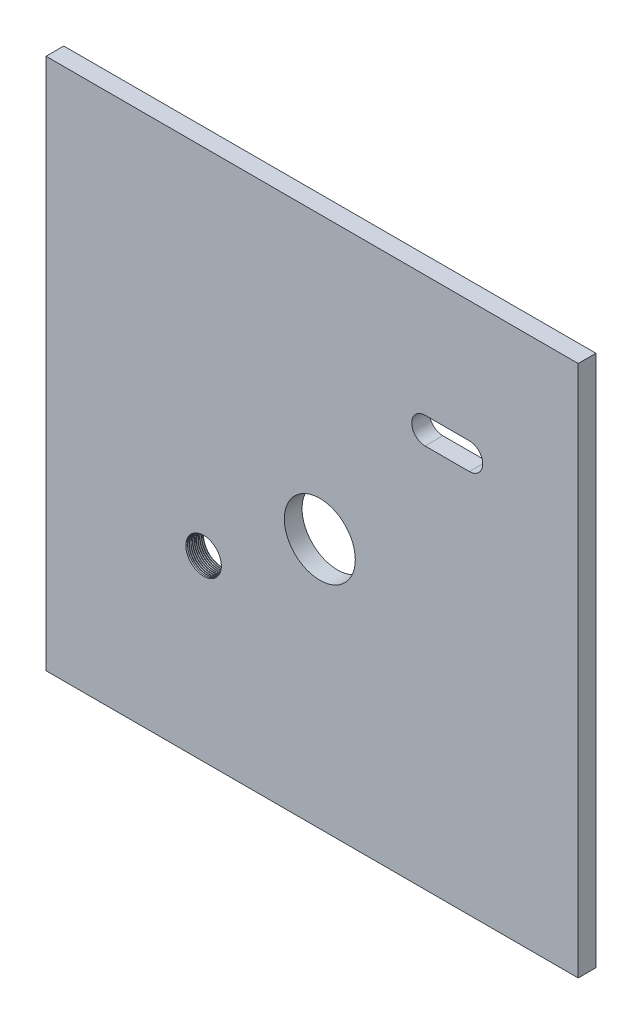
from build123d import *

# Parameters (mm, degrees)
SKETCH1_W           = 300
SKETCH1_H           = 300
BOSS_EXTRUDE1_DEPTH = 10
SKETCH4_R           = 10
SKETCH4_R_2         = 20
CUT_EXTRUDE1_DEPTH  = 10
THREAD1_PITCH       = 1


with BuildPart() as part:
    # Sketch1 → Boss-Extrude1 (new body)
    with BuildSketch(Plane.XY):
        with Locations((-150, 150)):
            Rectangle(SKETCH1_W, SKETCH1_H)
    extrude(amount=BOSS_EXTRUDE1_DEPTH)

    # Sketch4 → Cut-Extrude1 (cut)
    with BuildSketch(Plane.XY.offset(10)):
        with Locations((-211.177385616, 100.563728795)):
            Circle(SKETCH4_R)
        with Locations((-145.67432627, 141.348652539)):
            Circle(SKETCH4_R_2)
        with BuildLine():
            Line((-86.350800824, 231.569847487), (-61.350800824, 231.569847487))
            ThreePointArc((-61.350800824, 231.569847487), (-53.850800824, 224.069847487), (-61.350800824, 216.569847487))
            Line((-61.350800824, 216.569847487), (-86.350800824, 216.569847487))
            ThreePointArc((-86.350800824, 216.569847487), (-93.850800824, 224.069847487), (-86.350800824, 231.569847487))
        make_face()
    extrude(amount=-CUT_EXTRUDE1_DEPTH, mode=Mode.SUBTRACT)

    # Thread1: the profile of Thread Profile1 profile screwed along a right-hand helix of 10 turns, 8 arcs to a turn; built about Z, then put on its axis
    thread1_z = Axis((0, 0, 0), (0, 0, 1))
    thread1_corners = [(9.9997, 0, -0.000173205), (10.541265875, 0, 0.312499999), (10.541265875, 0, 0.437499999), (9.9997, 0, 0.750173202)]
    with BuildLine(mode=Mode.PRIVATE) as thread1_profile:
        Line(thread1_corners[0], thread1_corners[1])
        Line(thread1_corners[1], thread1_corners[2])
        Line(thread1_corners[2], thread1_corners[3])
        Line(thread1_corners[3], thread1_corners[0])
    thread1_cap = Face(thread1_profile.wire())
    thread1_turn_angles = [0, 22.5, 45, 67.5, 90, 112.5, 135, 157.5, 180, 202.5, 225, 247.5, 270, 292.5, 315, 337.5, 360]
    thread1_turn_weights = [1, 0.9238795325112867, 1, 0.9238795325112867, 1, 0.9238795325112867, 1, 0.9238795325112867, 1, 0.9238795325112867, 1, 0.9238795325112867, 1, 0.9238795325112867, 1, 0.9238795325112867, 1]
    thread1_turn_rails = [Edge.make_bspline([Vector(p[0], p[1], 0).rotate(thread1_z, thread1_turn_angles[k]) / thread1_turn_weights[k] + Vector(0, 0, p[2] + THREAD1_PITCH * thread1_turn_angles[k] / 360) for k in range(17)], [0, 0, 0, 1, 1, 2, 2, 3, 3, 4, 4, 5, 5, 6, 6, 7, 7, 8, 8, 8], 2, thread1_turn_weights) for p in thread1_corners]
    thread1_turn_sides = [Face.make_surface_from_curves(thread1_turn_rails[p[0]], thread1_turn_rails[p[1]]) for p in [(0, 1), (1, 2), (2, 3), (3, 0)]]
    thread1 = Plane(origin=(-211.177385616, 100.563728795, 10), x_dir=(-1, 0, 0), z_dir=(0, 0, -1)) * Solid(Shell([*[p.moved(Location((0, 0, THREAD1_PITCH * i))) for i in range(10) for p in thread1_turn_sides], thread1_cap, thread1_cap.rotate(thread1_z, 3600).moved(Location((0, 0, THREAD1_PITCH * 3600 / 360)))]))
    add(thread1, mode=Mode.SUBTRACT)


solid = part.part
